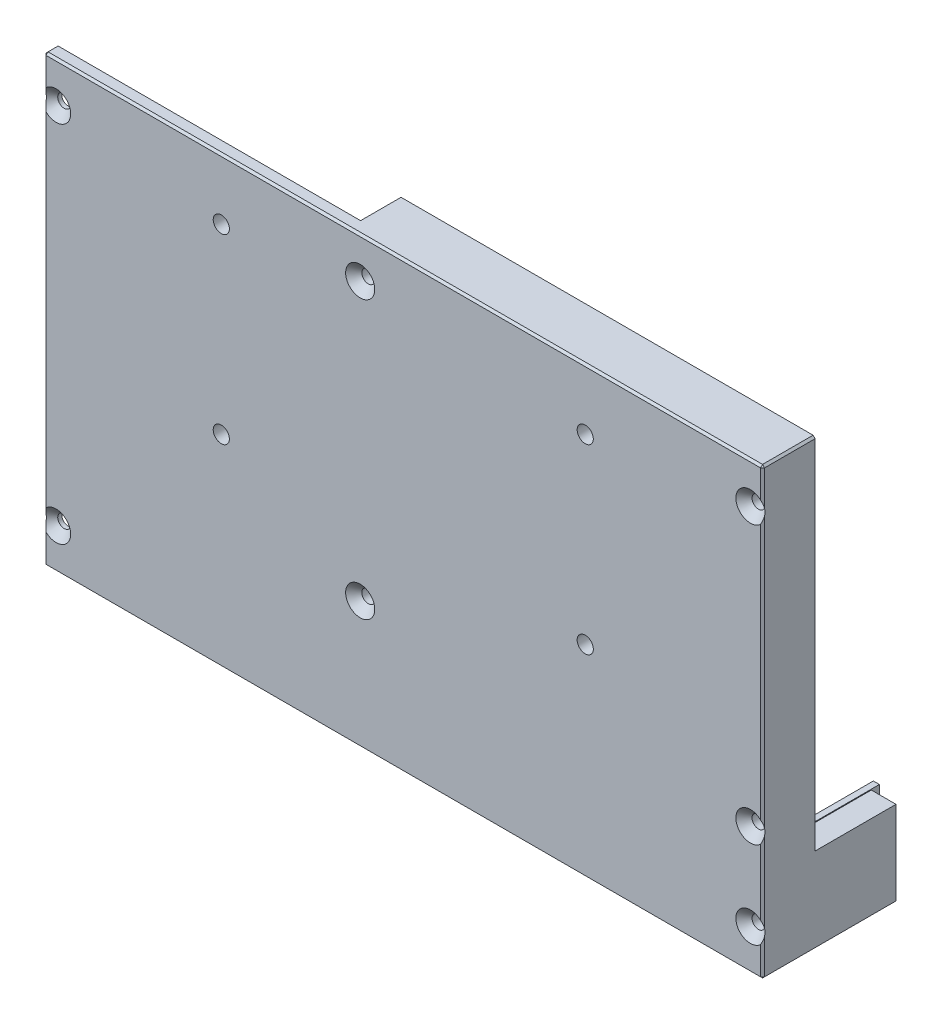
from build123d import *

# Parameters (mm, degrees)
ESQUISSE1_W             = 177.7
ESQUISSE1_H             = 110
BOSS_EXTRU_1_DEPTH      = 3
ESQUISSE2_W             = 102.6
ESQUISSE2_H             = 88.6
BOSS_EXTRU_2_DEPTH      = 10
BOSS_EXTRU_3_DEPTH      = 30
ESQUISSE4_W             = 6.1
ESQUISSE4_H             = 20
ENL_V_MAT_EXTRU_1_DEPTH = 0.2
ESQUISSE5_W             = 10
ESQUISSE5_H             = 3.2
ENL_V_MAT_EXTRU_2_DEPTH = 0.2
BOSS_EXTRU_4_DEPTH      = 2
BOSS_EXTRU_5_DEPTH      = 10
BOSS_EXTRU_6_DEPTH      = 30
ESQUISSE9_R             = 1.6
ENL_V_MAT_EXTRU_3_DEPTH = 212.901604524
CHANFREIN1_SIZE         = 2
CHANFREIN2_SIZE         = 0.5
ESQUISSE10_R            = 2
ENL_V_MAT_EXTRU_4_DEPTH = 5
ESQUISSE11_R            = 4
ESQUISSE11_R_2          = 2
BOSS_EXTRU_7_DEPTH      = 5
ESQUISSE13_W            = 18
ESQUISSE13_H            = 4.7
ENL_V_MAT_EXTRU_5_DEPTH = 7
ESQUISSE14_W            = 96.5
ESQUISSE14_H            = 0.5
BOSS_EXTRU_8_DEPTH      = 2


with BuildPart() as part:
    # Esquisse1 → Boss.-Extru.1 (new body)
    with BuildSketch(Plane.XY):
        with Locations((88.85, 55)):
            Rectangle(ESQUISSE1_W, ESQUISSE1_H)
    extrude(amount=BOSS_EXTRU_1_DEPTH)

    # Esquisse2 → Boss.-Extru.2 (add)
    with BuildSketch(Plane(origin=(0, 0, 0), x_dir=(-1, 0, 0), z_dir=(0, 0, -1))):
        with Locations((-126.4, 65.7)):
            Rectangle(ESQUISSE2_W, ESQUISSE2_H)
    extrude(amount=BOSS_EXTRU_2_DEPTH)

    # Esquisse3 → Boss.-Extru.3 (add)
    with BuildSketch(Plane(origin=(0, 0, 0), x_dir=(-1, 0, 0), z_dir=(0, 0, -1))):
        Polygon((-177.7, 21.4), (-171.6, 21.4), (-171.6, 3.2), (-16.2, 3.2), (-16.2, 0), (-177.7, 0), align=None)
    extrude(amount=BOSS_EXTRU_3_DEPTH)

    # Esquisse4 → Enlèv. mat.-Extru.1 (cut)
    with BuildSketch(Plane(origin=(0, 21.4, 0), x_dir=(1, 0, 0), z_dir=(0, 1, 0))):
        with Locations((174.65, 20)):
            Rectangle(ESQUISSE4_W, ESQUISSE4_H)
    extrude(amount=-ENL_V_MAT_EXTRU_1_DEPTH, mode=Mode.SUBTRACT)

    # Esquisse5 → Enlèv. mat.-Extru.2 (cut)
    with BuildSketch(Plane.ZY.offset(-75.1)):
        with Locations((-5, 108.4)):
            Rectangle(ESQUISSE5_W, ESQUISSE5_H)
    extrude(amount=-ENL_V_MAT_EXTRU_2_DEPTH, mode=Mode.SUBTRACT)

    # Esquisse6 → Boss.-Extru.4 (add)
    with BuildSketch(Plane(origin=(0, 0, 0), x_dir=(-1, 0, 0), z_dir=(0, 0, -1))):
        Polygon((-75.1, 106.8), (-6.1, 106.8), (-6.1, 3.2), (-171.6, 3.2), (-171.6, 21.4), (-75.1, 21.4), align=None)
        Polygon((-73.6, 105.3), (-7.6, 105.3), (-7.6, 4.7), (-170.1, 4.7), (-170.1, 19.9), (-73.6, 19.9), align=None, mode=Mode.SUBTRACT)
    extrude(amount=BOSS_EXTRU_4_DEPTH)

    # Esquisse7 → Boss.-Extru.5 (add)
    with BuildSketch(Plane(origin=(0, 0, -2), x_dir=(-1, 0, 0), z_dir=(0, 0, -1))):
        Polygon((-75.1, 106.8), (-73.6, 106.8), (-73.6, 19.4), (-171.6, 19.4), (-171.6, 21.4), (-75.1, 21.4), align=None)
    extrude(amount=BOSS_EXTRU_5_DEPTH)

    # Esquisse8 → Boss.-Extru.6 (add)
    with BuildSketch(Plane(origin=(0, 0, -2), x_dir=(-1, 0, 0), z_dir=(0, 0, -1))):
        Polygon((-14.2, 3.2), (-14.2, 4.7), (-170.1, 4.7), (-170.1, 21.4), (-171.6, 21.4), (-171.6, 3.2), align=None)
    extrude(amount=BOSS_EXTRU_6_DEPTH)

    # Esquisse9 → Enlèv. mat.-Extru.3 (cut, through all)
    with BuildSketch(Plane.XY.offset(3)):
        with Locations((3, 100)):
            Circle(ESQUISSE9_R)
        with Locations((3, 10)):
            Circle(ESQUISSE9_R)
        with Locations((174.7, 100)):
            Circle(ESQUISSE9_R)
        with Locations((174.7, 10)):
            Circle(ESQUISSE9_R)
        with Locations((78.2, 100)):
            Circle(ESQUISSE9_R)
        with Locations((78.2, 31.5)):
            Circle(ESQUISSE9_R)
        with Locations((174.7, 31.5)):
            Circle(ESQUISSE9_R)
    extrude(amount=-ENL_V_MAT_EXTRU_3_DEPTH, mode=Mode.SUBTRACT)

    # Chanfrein1
    # the kernel refuses this chamfer: 2 mm, written as the material it takes off along each edge
    with BuildSketch(Plane(origin=(78.2, 100, 3), x_dir=(1, 0, 0), z_dir=(0, -1, 0))) as chanfrein1_piece_1:
        Polygon((1.6 + CHANFREIN1_SIZE, 0), (1.6, -CHANFREIN1_SIZE), (1.6, 0), align=None)
    revolve(axis=Axis((78.2, 100, 3), (0, 0, 1)), mode=Mode.SUBTRACT)
    with BuildSketch(Plane(origin=(174.7, 10, 3), x_dir=(1, 0, 0), z_dir=(0, -1, 0))) as chanfrein1_piece_2:
        Polygon((1.6 + CHANFREIN1_SIZE, 0), (1.6, -CHANFREIN1_SIZE), (1.6, 0), align=None)
    revolve(axis=Axis((174.7, 10, 3), (0, 0, 1)), mode=Mode.SUBTRACT)
    with BuildSketch(Plane(origin=(174.7, 100, 3), x_dir=(1, 0, 0), z_dir=(0, -1, 0))) as chanfrein1_piece_3:
        Polygon((1.6 + CHANFREIN1_SIZE, 0), (1.6, -CHANFREIN1_SIZE), (1.6, 0), align=None)
    revolve(axis=Axis((174.7, 100, 3), (0, 0, 1)), mode=Mode.SUBTRACT)
    with BuildSketch(Plane(origin=(3, 10, 3), x_dir=(1, 0, 0), z_dir=(0, -1, 0))) as chanfrein1_piece_4:
        Polygon((1.6 + CHANFREIN1_SIZE, 0), (1.6, -CHANFREIN1_SIZE), (1.6, 0), align=None)
    revolve(axis=Axis((3, 10, 3), (0, 0, 1)), mode=Mode.SUBTRACT)
    with BuildSketch(Plane(origin=(78.2, 31.5, 3), x_dir=(1, 0, 0), z_dir=(0, -1, 0))) as chanfrein1_piece_5:
        Polygon((1.6 + CHANFREIN1_SIZE, 0), (1.6, -CHANFREIN1_SIZE), (1.6, 0), align=None)
    revolve(axis=Axis((78.2, 31.5, 3), (0, 0, 1)), mode=Mode.SUBTRACT)
    with BuildSketch(Plane(origin=(174.7, 31.5, 3), x_dir=(1, 0, 0), z_dir=(0, -1, 0))) as chanfrein1_piece_6:
        Polygon((1.6 + CHANFREIN1_SIZE, 0), (1.6, -CHANFREIN1_SIZE), (1.6, 0), align=None)
    revolve(axis=Axis((174.7, 31.5, 3), (0, 0, 1)), mode=Mode.SUBTRACT)
    with BuildSketch(Plane(origin=(3, 100, 3), x_dir=(1, 0, 0), z_dir=(0, -1, 0))) as chanfrein1_piece_7:
        Polygon((1.6 + CHANFREIN1_SIZE, 0), (1.6, -CHANFREIN1_SIZE), (1.6, 0), align=None)
    revolve(axis=Axis((3, 100, 3), (0, 0, 1)), mode=Mode.SUBTRACT)

    # Chanfrein2
    chanfrein2_edges = [part.edges().sort_by_distance(p)[0] for p in [
        (177.7, 65.75, 3),
        (177.7, 20.75, 3),
        (0, 4.005012563, 3),
        (177.7, 4.005012563, 3),
        (88.85, 0, 3),
        (0, 55, 3),
        (177.7, 105.994987437, 3),
        (0, 105.994987437, 3),
        (88.85, 110, 3),
        (0, 0, 1.5),
        (177.7, 0, -13.5),
        (0, 110, 1.5),
        (177.7, 110, -3.5),
    ]]
    chamfer(chanfrein2_edges, length=CHANFREIN2_SIZE)

    # Esquisse10 → Enlèv. mat.-Extru.4 (cut)
    with BuildSketch(Plane.XY.offset(3)):
        with Locations((43.85, 95)):
            Circle(ESQUISSE10_R)
        with Locations((43.85, 50)):
            Circle(ESQUISSE10_R)
        with Locations((133.85, 95)):
            Circle(ESQUISSE10_R)
        with Locations((133.85, 50)):
            Circle(ESQUISSE10_R)
    extrude(amount=-ENL_V_MAT_EXTRU_4_DEPTH, mode=Mode.SUBTRACT)

    # Esquisse11 → Boss.-Extru.7 (add)
    # profile 1 of 4: a face of its own
    with BuildSketch(Plane.XY.offset(3)):
        with Locations((43.85, 95)):
            Circle(ESQUISSE11_R)
        with Locations((43.85, 95)):
            Circle(ESQUISSE11_R_2, mode=Mode.SUBTRACT)
    # profile 2 of 4: a face of its own
    with BuildSketch(Plane.XY.offset(3)):
        with Locations((43.85, 50)):
            Circle(ESQUISSE11_R)
        with Locations((43.85, 50)):
            Circle(ESQUISSE11_R_2, mode=Mode.SUBTRACT)
    # profile 3 of 4: a face of its own
    with BuildSketch(Plane.XY.offset(3)):
        with Locations((133.85, 95)):
            Circle(ESQUISSE11_R)
        with Locations((133.85, 95)):
            Circle(ESQUISSE11_R_2, mode=Mode.SUBTRACT)
    # profile 4 of 4: a face of its own
    with BuildSketch(Plane.XY.offset(3)):
        with Locations((133.85, 50)):
            Circle(ESQUISSE11_R)
        with Locations((133.85, 50)):
            Circle(ESQUISSE11_R_2, mode=Mode.SUBTRACT)
    extrude(amount=-BOSS_EXTRU_7_DEPTH)

    # Esquisse13 → Enlèv. mat.-Extru.5 (cut)
    with BuildSketch(Plane(origin=(0, 0, -32), x_dir=(-1, 0, 0), z_dir=(0, 0, -1))):
        with Locations((-30.2, 2.35)):
            Rectangle(ESQUISSE13_W, ESQUISSE13_H)
        with Locations((-58.2, 2.35)):
            Rectangle(ESQUISSE13_W, ESQUISSE13_H)
    extrude(amount=-ENL_V_MAT_EXTRU_5_DEPTH, mode=Mode.SUBTRACT)

    # Esquisse14 → Boss.-Extru.8 (add)
    with BuildSketch(Plane.XY.offset(-2)):
        with Locations((121.85, 19.65)):
            Rectangle(ESQUISSE14_W, ESQUISSE14_H)
    extrude(amount=BOSS_EXTRU_8_DEPTH)


solid = part.part
